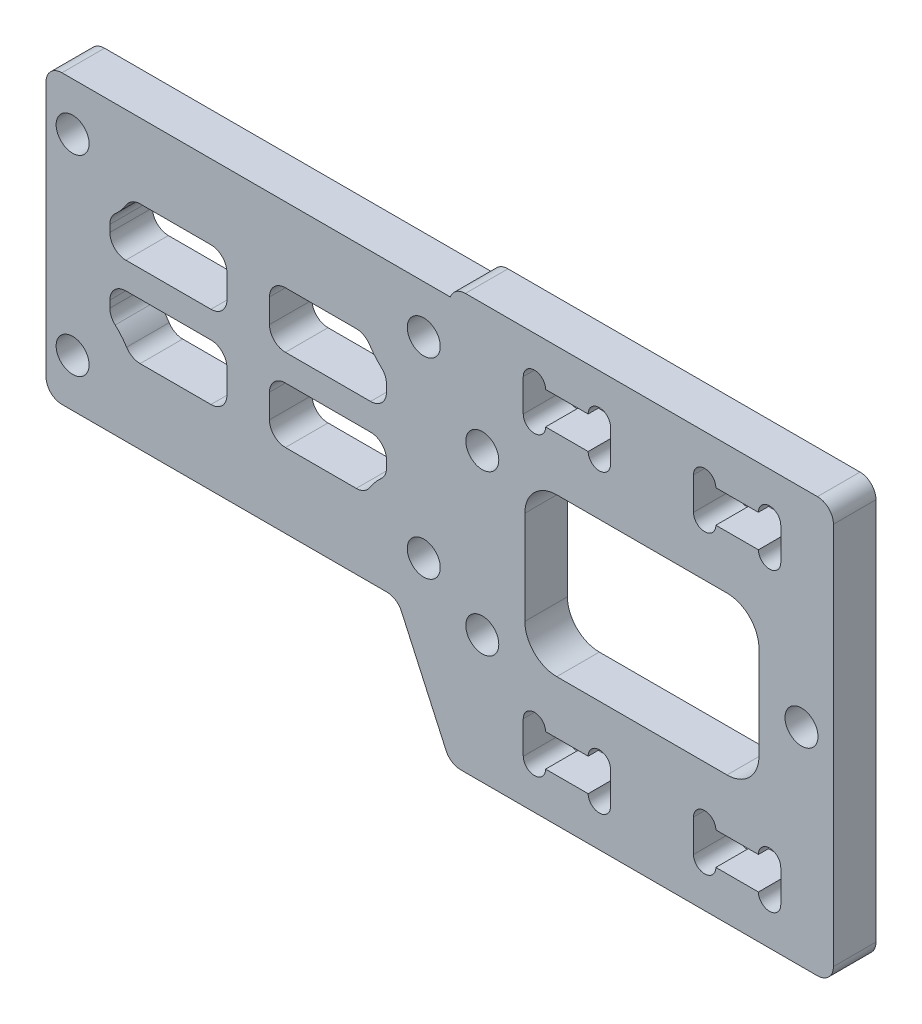
from build123d import *

# Parameters (mm, degrees)
SKETCH_1_R      = 1.55
SKETCH_1_W      = 22
SKETCH_1_H      = 14.8
EXTRUDE_1_DEPTH = 4
FILLET_4_R      = 3
FILLET_2_R      = 1.5


with BuildPart() as part:
    # 草图1 → 凸台-拉伸1 (new body)
    with BuildSketch(Plane.XY):
        Polygon((19, 14.5), (19, 13.5), (-18, 13.5), (-19, 13.5), (-19, -13.5), (14, -13.5), (19, -24.5), (55, -24.5), (55, 14.5), align=None)
        with BuildLine():
            ThreePointArc((-18, -9.390512484), (-18.05, -9), (-18, -8.609487516))
            ThreePointArc((-18, -8.609487516), (-14.95, -9), (-18, -9.390512484))
        make_face(mode=Mode.SUBTRACT)
        with Locations((16.5, -9)):
            Circle(SKETCH_1_R, mode=Mode.SUBTRACT)
        with BuildLine():
            ThreePointArc((31.95, -17.4), (33, -16.35), (34.05, -17.4))
            Line((34.05, -17.4), (34.05, -20.45))
            ThreePointArc((34.05, -20.45), (33, -21.5), (31.95, -20.45))
            Line((31.95, -20.45), (27.95, -20.45))
            ThreePointArc((27.95, -20.45), (26.9, -21.5), (25.85, -20.45))
            Line((25.85, -20.45), (25.85, -17.4))
            ThreePointArc((25.85, -17.4), (26.9, -16.35), (27.95, -17.4))
            Line((27.95, -17.4), (31.95, -17.4))
        make_face(mode=Mode.SUBTRACT)
        with BuildLine():
            ThreePointArc((47.95, -17.4), (49, -16.35), (50.05, -17.4))
            Line((50.05, -17.4), (50.05, -20.45))
            ThreePointArc((50.05, -20.45), (49, -21.5), (47.95, -20.45))
            Line((47.95, -20.45), (43.95, -20.45))
            ThreePointArc((43.95, -20.45), (42.9, -21.5), (41.85, -20.45))
            Line((41.85, -20.45), (41.85, -17.4))
            ThreePointArc((41.85, -17.4), (42.9, -16.35), (43.95, -17.4))
            Line((43.95, -17.4), (47.95, -17.4))
        make_face(mode=Mode.SUBTRACT)
        with Locations((22, -12.5)):
            Circle(SKETCH_1_R, mode=Mode.SUBTRACT)
        with BuildLine():
            ThreePointArc((-11.045643943, -6.5), (-11.868221008, -5.185996413), (-13, -4.126602828))
            Line((-13, -4.126602828), (-13, -1.25))
            Line((-13, -1.25), (-2, -1.25))
            Line((-2, -1.25), (-2, -6.5))
            Line((-2, -6.5), (-11.045643943, -6.5))
        make_face(mode=Mode.SUBTRACT)
        with BuildLine():
            Line((-11.045643943, 6.5), (-2, 6.5))
            Line((-2, 6.5), (-2, 1.25))
            Line((-2, 1.25), (-13, 1.25))
            Line((-13, 1.25), (-13, 4.126602828))
            ThreePointArc((-13, 4.126602828), (-11.868221008, 5.185996413), (-11.045643943, 6.5))
        make_face(mode=Mode.SUBTRACT)
        with BuildLine():
            ThreePointArc((13, -4.126602828), (11.868221008, -5.185996413), (11.045643943, -6.5))
            Line((11.045643943, -6.5), (2, -6.5))
            Line((2, -6.5), (2, -1.25))
            Line((2, -1.25), (13, -1.25))
            Line((13, -1.25), (13, -4.126602828))
        make_face(mode=Mode.SUBTRACT)
        with BuildLine():
            Line((2, 6.5), (11.045643943, 6.5))
            ThreePointArc((11.045643943, 6.5), (11.868221008, 5.185996413), (13, 4.126602828))
            Line((13, 4.126602828), (13, 1.25))
            Line((13, 1.25), (2, 1.25))
            Line((2, 1.25), (2, 6.5))
        make_face(mode=Mode.SUBTRACT)
        with BuildLine():
            ThreePointArc((-18, 8.609487516), (-18.05, 9), (-18, 9.390512484))
            ThreePointArc((-18, 9.390512484), (-14.95, 9), (-18, 8.609487516))
        make_face(mode=Mode.SUBTRACT)
        with Locations((16.5, 9)):
            Circle(SKETCH_1_R, mode=Mode.SUBTRACT)
        with Locations((22, 2.5)):
            Circle(SKETCH_1_R, mode=Mode.SUBTRACT)
        with Locations((37, -5)):
            Rectangle(SKETCH_1_W, SKETCH_1_H, mode=Mode.SUBTRACT)
        with Locations((52, -5)):
            Circle(SKETCH_1_R, mode=Mode.SUBTRACT)
        with BuildLine():
            ThreePointArc((27.95, 7.4), (26.9, 6.35), (25.85, 7.4))
            Line((25.85, 7.4), (25.85, 10.45))
            ThreePointArc((25.85, 10.45), (26.9, 11.5), (27.95, 10.45))
            Line((27.95, 10.45), (31.95, 10.45))
            ThreePointArc((31.95, 10.45), (33, 11.5), (34.05, 10.45))
            Line((34.05, 10.45), (34.05, 7.4))
            ThreePointArc((34.05, 7.4), (33, 6.35), (31.95, 7.4))
            Line((31.95, 7.4), (27.95, 7.4))
        make_face(mode=Mode.SUBTRACT)
        with BuildLine():
            ThreePointArc((43.95, 7.4), (42.9, 6.35), (41.85, 7.4))
            Line((41.85, 7.4), (41.85, 10.45))
            ThreePointArc((41.85, 10.45), (42.9, 11.5), (43.95, 10.45))
            Line((43.95, 10.45), (47.95, 10.45))
            ThreePointArc((47.95, 10.45), (49, 11.5), (50.05, 10.45))
            Line((50.05, 10.45), (50.05, 7.4))
            ThreePointArc((50.05, 7.4), (49, 6.35), (47.95, 7.4))
            Line((47.95, 7.4), (43.95, 7.4))
        make_face(mode=Mode.SUBTRACT)
    extrude(amount=EXTRUDE_1_DEPTH)

    # 圆角4
    fillet_4_edges = [part.edges().sort_by_distance(p)[0] for p in [
        (48, -12.4, 2),
        (48, 2.4, 2),
        (26, 2.4, 2),
        (26, -12.4, 2),
    ]]
    fillet(fillet_4_edges, radius=FILLET_4_R)

    # 圆角2
    # the kernel refuses this fillet: 1.5 mm, written as the material it adds along each edge
    with BuildSketch(Plane(origin=(13, -4.126602828, 0), x_dir=(-0.7799082452950566, -0.6258938639424306, 0), z_dir=(0, 0, 1)), Plane(origin=(-13, 4.126602828, 0), x_dir=(0.7799082452950533, 0.6258938639424346, 0), z_dir=(0, 0, 1))) as fillet_2_piece_1:
        with BuildLine():
            CenterArc((0.721238689, -1.49785779), FILLET_2_R, 93.062490092, 48.189685104)
            Line((-0.448623679, -0.559016994), (0, 0))
            ThreePointArc((0, 0), (0.320550528, -0.008568839), (0.641101056, 0))
        make_face()
    extrude(amount=4)
    with BuildSketch(Plane(origin=(-2, 6.5, 0), x_dir=(-1, 0, 0), z_dir=(0, 0, 1)), Plane(origin=(2, 1.25, 0), x_dir=(1, 0, 0), z_dir=(0, 0, 1)), Plane(origin=(13, 1.25, 0), x_dir=(0, 1, 0), z_dir=(0, 0, 1)), Plane(origin=(13, -1.25, 0), x_dir=(-1, 0, 0), z_dir=(0, 0, 1)), Plane(origin=(2, -1.25, 0), x_dir=(0, -1, 0), z_dir=(0, 0, 1)), Plane(origin=(2, -6.5, 0), x_dir=(1, 0, 0), z_dir=(0, 0, 1)), Plane(origin=(-2, -6.5, 0), x_dir=(0, 1, 0), z_dir=(0, 0, 1)), Plane(origin=(-2, -1.25, 0), x_dir=(-1, 0, 0), z_dir=(0, 0, 1)), Plane(origin=(-13, -1.25, 0), x_dir=(0, -1, 0), z_dir=(0, 0, 1)), Plane(origin=(-13, 1.25, 0), x_dir=(1, 0, 0), z_dir=(0, 0, 1)), Plane(origin=(-2, 1.25, 0), x_dir=(0, 1, 0), z_dir=(0, 0, 1))) as fillet_2_piece_2:
        with BuildLine():
            CenterArc((FILLET_2_R, FILLET_2_R), FILLET_2_R, 180, 90)
            Line((0, FILLET_2_R), (0, 0))
            Line((0, 0), (FILLET_2_R, 0))
        make_face()
    extrude(amount=4)
    with BuildSketch(Plane(origin=(2, 6.5, 0), x_dir=(1, 0, 0), z_dir=(0, 0, 1))) as fillet_2_piece_3:
        with BuildLine():
            CenterArc((FILLET_2_R, -FILLET_2_R), FILLET_2_R, 90, 90)
            Line((0, -FILLET_2_R), (0, 0))
            Line((0, 0), (FILLET_2_R, 0))
        make_face()
    extrude(amount=4)
    with BuildSketch(Plane(origin=(-11.045643943, 6.5, 0), x_dir=(-0.47604843493949917, -0.8794190625587175, 0), z_dir=(0, 0, 1)), Plane(origin=(11.045643943, -6.5, 0), x_dir=(0.47604843493949517, 0.8794190625587197, 0), z_dir=(0, 0, 1))) as fillet_2_piece_4:
        with BuildLine():
            CenterArc((0.895477519, 1.496696445), FILLET_2_R, 208.427635494, 57.769047364)
            Line((-0.423651075, 0.782623792), (0, 0))
            ThreePointArc((0, 0), (0.397990008, 0.013214222), (0.795980017, 0))
        make_face()
    extrude(amount=4)
    with BuildSketch(Plane(origin=(-11.045643943, -6.5, 0), x_dir=(-0.4760484349394948, 0.8794190625587198, 0), z_dir=(0, 0, 1))) as fillet_2_piece_5:
        with BuildLine():
            CenterArc((0.895477519, -1.496696445), FILLET_2_R, 93.803317142, 57.769047364)
            Line((-0.423651075, -0.782623792), (0, 0))
            ThreePointArc((0, 0), (0.397990008, -0.013214222), (0.795980017, 0))
        make_face()
    extrude(amount=4)
    with BuildSketch(Plane(origin=(-13, -4.126602828, 0), x_dir=(0.7799082452950538, -0.6258938639424342, 0), z_dir=(0, 0, 1)), Plane(origin=(13, 4.126602828, 0), x_dir=(-0.779908245295054, 0.6258938639424338, 0), z_dir=(0, 0, 1))) as fillet_2_piece_6:
        with BuildLine():
            CenterArc((0.721238689, 1.49785779), FILLET_2_R, 218.747824804, 48.189685104)
            Line((-0.448623679, 0.559016994), (0, 0))
            ThreePointArc((0, 0), (0.320550528, 0.008568839), (0.641101056, 0))
        make_face()
    extrude(amount=4)
    with BuildSketch(Plane(origin=(14, -13.5, 0), x_dir=(-1, 0, 0), z_dir=(0, 0, 1))) as fillet_2_piece_7:
        with BuildLine():
            CenterArc((FILLET_2_R * 0.643913270327, FILLET_2_R), FILLET_2_R, 204.44395478, 65.55604522)
            Line((-FILLET_2_R * 0.266453207136, FILLET_2_R * 0.586197055699), (0, 0))
            Line((0, 0), (FILLET_2_R * 0.643913270327, 0))
        make_face()
    extrude(amount=4)
    with BuildSketch(Plane(origin=(11.045643943, 6.5, 0), x_dir=(-1, 0, 0), z_dir=(0, 0, 1))) as fillet_2_piece_8:
        with BuildLine():
            CenterArc((0.889932713, 1.5), FILLET_2_R, 212.230952636, 57.769047364)
            ThreePointArc((-0.378925041, 0.7), (-0.177841682, 0.35629061), (0, 0))
            Line((0, 0), (0.889932713, 0))
        make_face()
    extrude(amount=4)
    # the kernel refuses this fillet: 1.5 mm, written as the material it takes off along each edge
    with BuildSketch(Plane(origin=(55, -24.5, -3.75), x_dir=(-1, 0, 0), z_dir=(0, 0, 1)), Plane(origin=(-19, 13.5, -3.75), x_dir=(1, 0, 0), z_dir=(0, 0, 1)), Plane(origin=(-19, -13.5, -3.75), x_dir=(0, 1, 0), z_dir=(0, 0, 1))) as fillet_2_2_piece_1:
        with BuildLine():
            CenterArc((FILLET_2_R, -FILLET_2_R), FILLET_2_R, 90, 90)
            Line((0, -FILLET_2_R), (0, 0))
            Line((0, 0), (FILLET_2_R, 0))
        make_face()
    extrude(amount=11.5, mode=Mode.SUBTRACT)
    with BuildSketch(Plane(origin=(55, 14.5, -3.75), x_dir=(-1, 0, 0), z_dir=(0, 0, 1))) as fillet_2_2_piece_2:
        with BuildLine():
            CenterArc((FILLET_2_R, FILLET_2_R), FILLET_2_R, 180, 90)
            Line((0, FILLET_2_R), (0, 0))
            Line((0, 0), (FILLET_2_R, 0))
        make_face()
    extrude(amount=11.5, mode=Mode.SUBTRACT)
    with BuildSketch(Plane(origin=(19, 14.5, -3.535533906), x_dir=(1, 0, 0), z_dir=(0, 0, 1))) as fillet_2_2_piece_3:
        with BuildLine():
            CenterArc((1.414213562, -1.5), FILLET_2_R, 90, 70.528779366)
            Line((0, -1), (0, 0))
            Line((0, 0), (1.414213562, 0))
        make_face()
    extrude(amount=11.071067812, mode=Mode.SUBTRACT)
    with BuildSketch(Plane(origin=(19, -24.5, -2.414674764), x_dir=(-0.4138029443011837, 0.9103664774626049, 0), z_dir=(0, 0, 1))) as fillet_2_2_piece_4:
        with BuildLine():
            CenterArc((FILLET_2_R * 0.643913270327, -FILLET_2_R), FILLET_2_R, 90, 65.55604522)
            Line((-FILLET_2_R * 0.266453207136, -FILLET_2_R * 0.586197055699), (0, 0))
            Line((0, 0), (FILLET_2_R * 0.643913270327, 0))
        make_face()
    extrude(amount=8.829349527, mode=Mode.SUBTRACT)


solid = part.part
